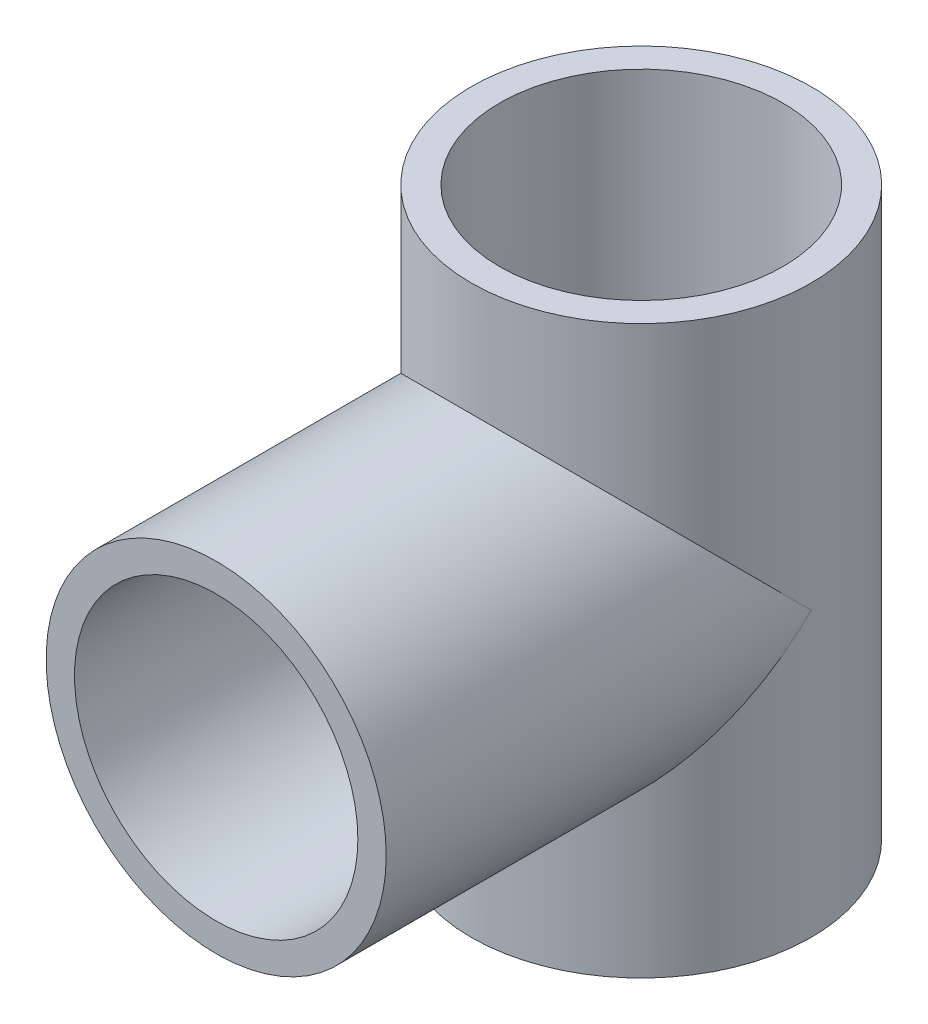
from build123d import *
from build123d.topology import SkipClean

# Parameters (mm, degrees)
SKETCH_1_R          = 12
SKETCH_1_R_2        = 10
EXTRUDE_1_DEPTH     = 20
SKETCH_2_R          = 12
SKETCH_2_R_2        = 10
EXTRUDE_2_DEPTH     = 30
SKETCH_2_2_R        = 10
CUT_EXTRUDE_1_DEPTH = 30
SKETCH_1_2_R        = 10
CUT_EXTRUDE_2_DEPTH = 15


with BuildPart() as part:
    # 草图1 → 凸台-拉伸1 (new, symmetric)
    with BuildSketch(Plane(origin=(0, 0, 0), x_dir=(1, 0, 0), z_dir=(0, 1, 0))):
        Circle(SKETCH_1_R)
        Circle(SKETCH_1_R_2, mode=Mode.SUBTRACT)
    extrude(amount=EXTRUDE_1_DEPTH, both=True)

    # 草图2 → 凸台-拉伸2 (add)
    with BuildSketch(Plane.XY):
        Circle(SKETCH_2_R)
        Circle(SKETCH_2_R_2, mode=Mode.SUBTRACT)
    extrude(amount=EXTRUDE_2_DEPTH)

    # 草图2<2> → 切除-拉伸1 (cut)
    with BuildSketch(Plane.XY):
        Circle(SKETCH_2_2_R)
    extrude(amount=CUT_EXTRUDE_1_DEPTH, mode=Mode.SUBTRACT)

    # 草图1<2> → 切除-拉伸2 (cut, symmetric)
    with SkipClean():  # the faces are left unmerged after this step: merging them gives an invalid solid
        with BuildSketch(Plane(origin=(0, 0, 0), x_dir=(1, 0, 0), z_dir=(0, 1, 0))):
            Circle(SKETCH_1_2_R)
        extrude(amount=CUT_EXTRUDE_2_DEPTH, both=True, mode=Mode.SUBTRACT)


solid = part.part
